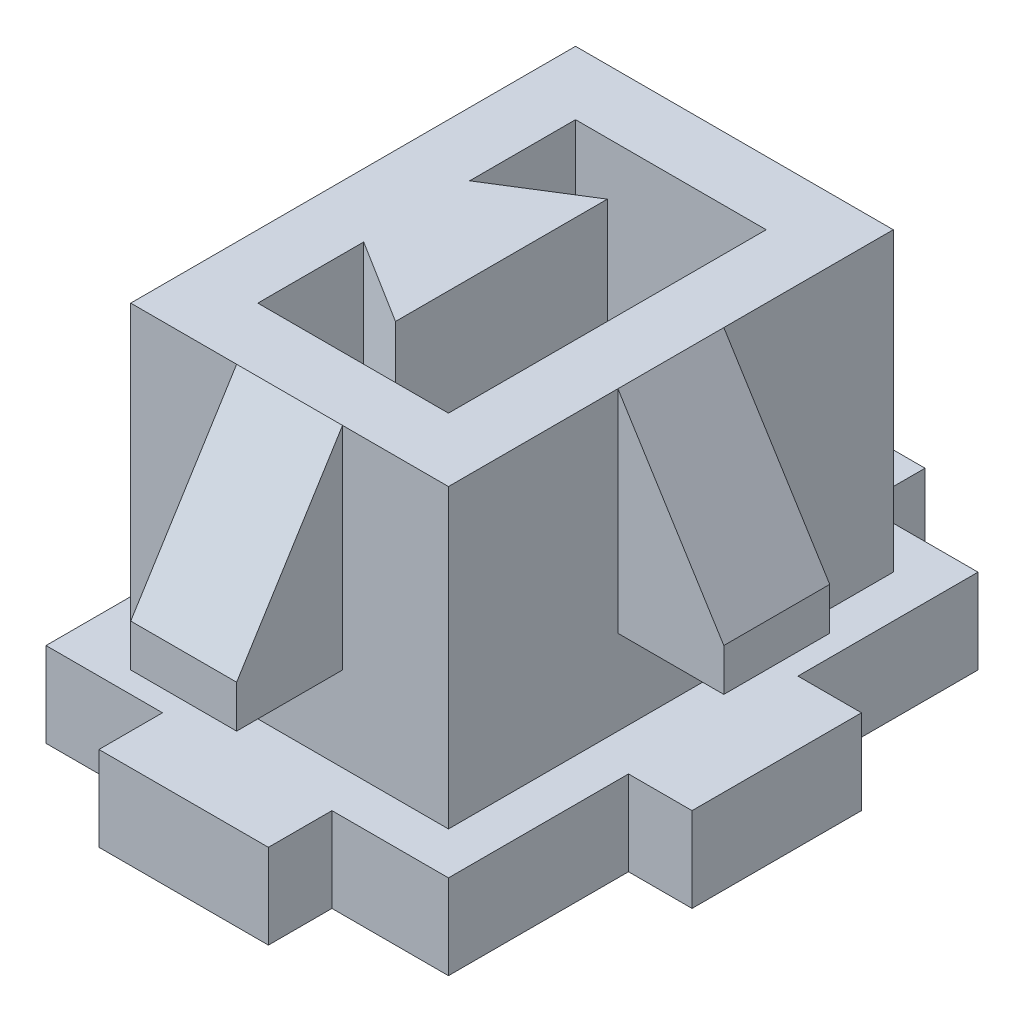
from build123d import *

# Parameters (mm, degrees)
BOSS_EXTRUDE1_DEPTH      = 15
BOSS_EXTRUDE2_DEPTH      = 18
BOSS_EXTRUDE3_DEPTH      = 1
BOSS_EXTRUDE3_DEPTH_BACK = 3
SKETCH3_W                = 19
SKETCH3_H                = 25
SKETCH3_W_2              = 15
SKETCH3_H_2              = 21
SKETCH4_W                = 8
SKETCH4_H                = 4
BOSS_EXTRUDE4_DEPTH      = 3
SKETCH5_W                = 8
SKETCH5_H                = 4
BOSS_EXTRUDE5_DEPTH      = 3
SKETCH6_W                = 5
SKETCH6_H                = 10
BOSS_EXTRUDE6_DEPTH      = 5
CUT_EXTRUDE1_DEPTH       = 27.272609311
SKETCH8_W                = 5
SKETCH8_H                = 10
BOSS_EXTRUDE7_DEPTH      = 5
CUT_EXTRUDE2_DEPTH       = 5


# Read off the part's stored shape, not the designer's step: Split1
with BuildPart() as part:
    # Sketch1 → Boss-Extrude1 (new body)
    with BuildSketch(Plane(origin=(0, 0, 0), x_dir=(1, 0, 0), z_dir=(0, 1, 0))):
        Polygon((-4, 7.5), (-4, 2.5), (0, 5), (0, -5), (-4, -2.5), (-4, -7.5), (5, -7.5), (5, 7.5), align=None)
    extrude(amount=BOSS_EXTRUDE1_DEPTH)


with BuildPart() as body_2:
    # Sketch2 → Boss-Extrude2 (new body)
    with BuildSketch(Plane(origin=(0, 15, 0), x_dir=(1, 0, 0), z_dir=(0, 1, 0))):
        Polygon((-7, 2.5), (-7, -2.5), (-7, -10.5), (8, -10.5), (8, 10.5), (-7, 10.5), align=None)
    extrude(amount=-BOSS_EXTRUDE2_DEPTH)

    # Combine3: cut part
    add(part.part, mode=Mode.SUBTRACT)


with BuildPart() as body_2_2:
    # Split1: the piece on the far side of the plane
    add(body_2.part)
    split(bisect_by=Plane(origin=(0, 0, 0), x_dir=(1, 0, 0), z_dir=(0, 1, 0)), keep=Keep.BOTTOM)

    # Sketch3 → Boss-Extrude3 (add, two sides: drawn at the far end of the back side and taken through both)
    with BuildSketch(Plane(origin=(0, 0, 0), x_dir=(1, 0, 0), z_dir=(0, 1, 0)).offset(-BOSS_EXTRUDE3_DEPTH_BACK)):
        with Locations((0.5, 0)):
            Rectangle(SKETCH3_W, SKETCH3_H)
        with Locations((0.5, 0)):
            Rectangle(SKETCH3_W_2, SKETCH3_H_2, mode=Mode.SUBTRACT)
    extrude(amount=BOSS_EXTRUDE3_DEPTH + BOSS_EXTRUDE3_DEPTH_BACK)

    # Sketch4 → Boss-Extrude4 (add)
    with BuildSketch(Plane(origin=(0, 0, -12.5), x_dir=(-1, 0, 0), z_dir=(0, 0, -1))):
        with Locations((-0.5, -1)):
            Rectangle(SKETCH4_W, SKETCH4_H)
    boss_extrude4 = extrude(amount=BOSS_EXTRUDE4_DEPTH)

    # Mirror1: Boss-Extrude4 across plane
    add(boss_extrude4.mirror(Plane.XY))

    # Sketch5 → Boss-Extrude5 (add)
    with BuildSketch(Plane.ZY.offset(9)):
        with Locations((0, -1)):
            Rectangle(SKETCH5_W, SKETCH5_H)
    boss_extrude5 = extrude(amount=BOSS_EXTRUDE5_DEPTH)

    # Mirror2: Boss-Extrude5 across plane
    add(boss_extrude5.mirror(Plane(origin=(0.5, 0, 0), x_dir=(0, 0, 1), z_dir=(1, 0, 0))))


with BuildPart() as body_2_1:
    add(body_2.part)

    # Split1
    split(bisect_by=Plane(origin=(0, 0, 0), x_dir=(1, 0, 0), z_dir=(0, 1, 0)), keep=Keep.TOP)

    # Sketch6 → Boss-Extrude6 (add)
    with BuildSketch(Plane(origin=(0, 0, -10.5), x_dir=(-1, 0, 0), z_dir=(0, 0, -1))):
        with Locations((-0.5, 10)):
            Rectangle(SKETCH6_W, SKETCH6_H)
    boss_extrude6 = extrude(amount=BOSS_EXTRUDE6_DEPTH)

    # Sketch7 → Cut-Extrude1 (cut, through all)
    with BuildSketch(Plane(origin=(3, 0, 0), x_dir=(0, 0, -1), z_dir=(1, 0, 0))):
        Polygon((10.5, 15), (15.5, 7), (15.5, 15), align=None)
    cut_extrude1 = extrude(amount=-CUT_EXTRUDE1_DEPTH, mode=Mode.SUBTRACT)

    # Mirror3: Boss-Extrude6, Cut-Extrude1 across plane
    add(boss_extrude6.mirror(Plane.XY))
    add(cut_extrude1.mirror(Plane.XY), mode=Mode.SUBTRACT)

    # Sketch8 → Boss-Extrude7 (add)
    with BuildSketch(Plane(origin=(8, 0, 0), x_dir=(0, 0, -1), z_dir=(1, 0, 0))):
        with Locations((0, 10)):
            Rectangle(SKETCH8_W, SKETCH8_H)
    boss_extrude7 = extrude(amount=BOSS_EXTRUDE7_DEPTH)

    # Sketch9 → Cut-Extrude2 (cut)
    with BuildSketch(Plane(origin=(0, 0, -2.5), x_dir=(-1, 0, 0), z_dir=(0, 0, -1))):
        Polygon((-13, 15), (-13, 7), (-8, 15), align=None)
    cut_extrude2 = extrude(amount=-CUT_EXTRUDE2_DEPTH, mode=Mode.SUBTRACT)

    # Mirror4: Boss-Extrude7, Cut-Extrude2 across plane
    add(boss_extrude7.mirror(Plane(origin=(0.5, 0, 0), x_dir=(0, 0, 1), z_dir=(1, 0, 0))))
    add(cut_extrude2.mirror(Plane(origin=(0.5, 0, 0), x_dir=(0, 0, 1), z_dir=(1, 0, 0))), mode=Mode.SUBTRACT)


solid = Compound([body_2_2.part, body_2_1.part])
